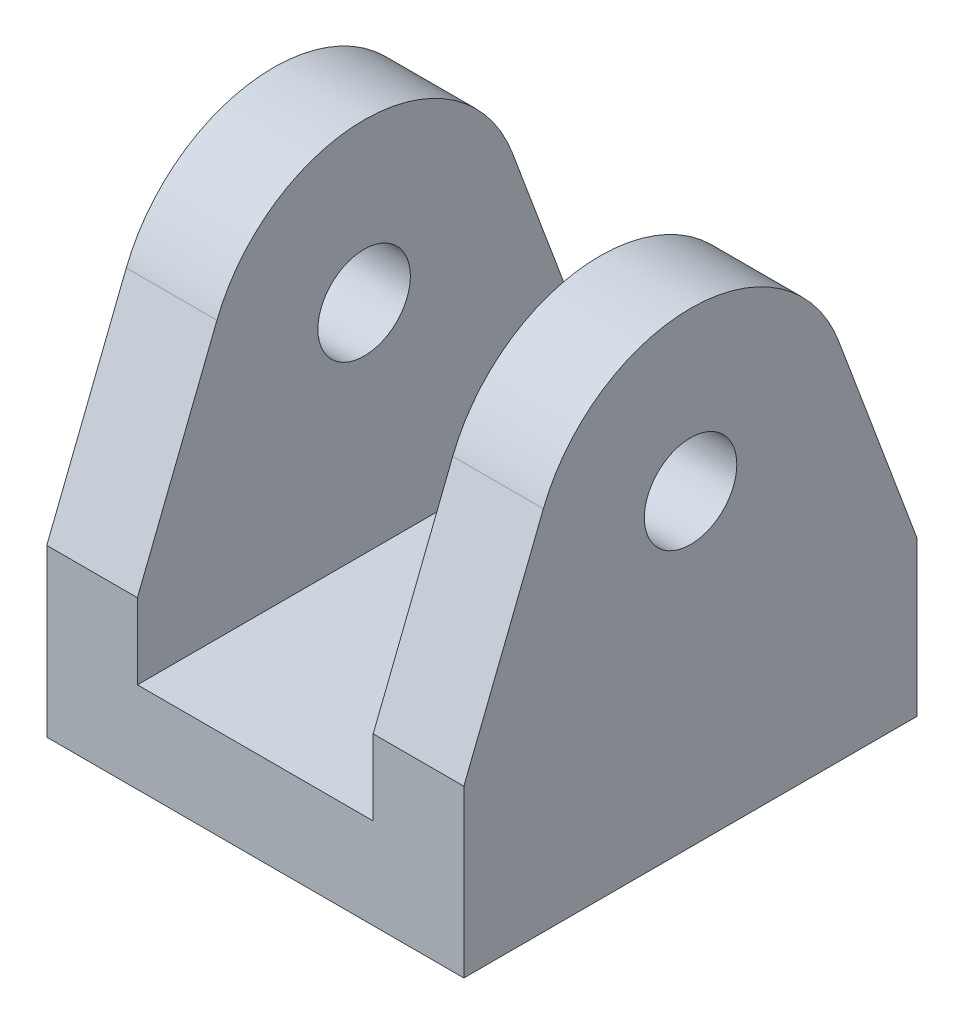
from build123d import *

# Parameters (mm, degrees)
BOSS_EXTRUDE1_DEPTH = 12.5
SKETCH2_R           = 2.55
CUT_EXTRUDE1_DEPTH  = 21.5


with BuildPart() as part:
    # Sketch1 → Boss-Extrude1 (new, symmetric)
    with BuildSketch(Plane.XY):
        Polygon((-6.5, 5), (6.5, 5), (6.5, 25.729927007), (11.5, 25.729927007), (11.5, 0), (-11.5, 0), (-11.5, 25.729927007), (-6.5, 25.729927007), align=None)
    extrude(amount=BOSS_EXTRUDE1_DEPTH, both=True)

    # Sketch2 → Cut-Extrude1 (cut, symmetric)
    with BuildSketch(Plane(origin=(0, 0, 0), x_dir=(0, 0, -1), z_dir=(1, 0, 0))):
        with BuildLine():
            Line((-12.5, 25.729927007), (-12.5, 9.159373111))
            Line((-12.5, 9.159373111), (-8.115271661, 20.217761866))
            ThreePointArc((-8.115271661, 20.217761866), (-4.905140127, 24.221580567), (0, 25.729927007))
            Line((0, 25.729927007), (-12.5, 25.729927007))
        make_face()
        with BuildLine():
            Line((12.5, 25.729927007), (0, 25.729927007))
            ThreePointArc((0, 25.729927007), (4.976994116, 24.172248958), (8.177901336, 20.055086791))
            Line((8.177901336, 20.055086791), (12.5, 8.485629403))
            Line((12.5, 8.485629403), (12.5, 25.729927007))
        make_face()
        with Locations((0, 17)):
            Circle(SKETCH2_R)
    extrude(amount=CUT_EXTRUDE1_DEPTH, both=True, mode=Mode.SUBTRACT)


solid = part.part
